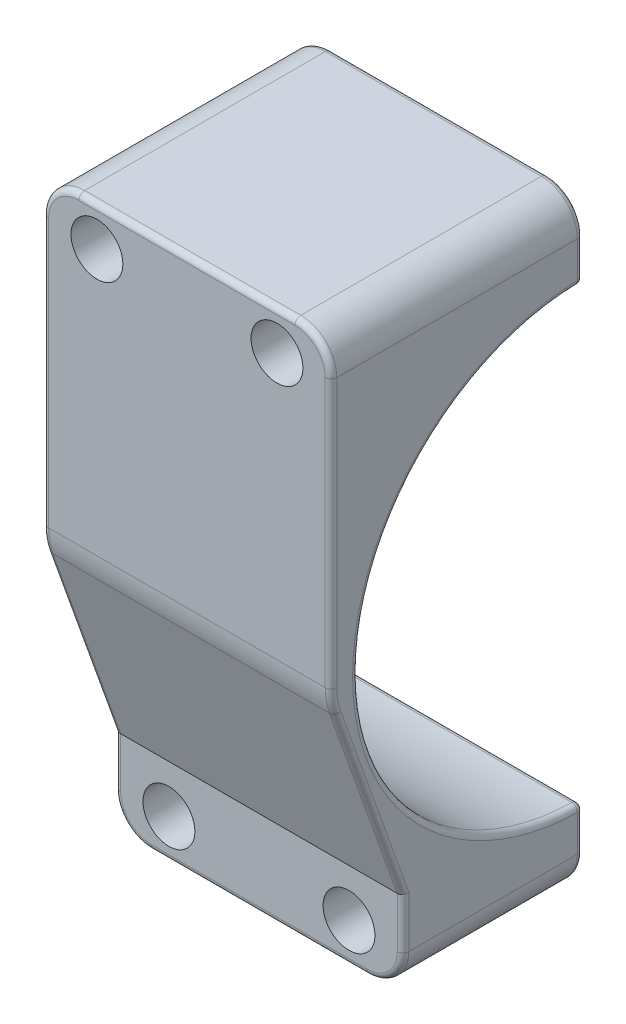
from build123d import *
from build123d.topology import SkipClean

# Parameters (mm, degrees)
BOSS_EXTRUDE1_DEPTH       = 25.4
F_8_0_18_DIAMETER_HOLE1_D = 4.572
SKETCH8_W                 = 22.225
SKETCH8_H                 = 53.34
CUT_EXTRUDE1_DEPTH        = 74.933200255
CUT_EXTRUDE2_DEPTH        = 74.933200255
FILLET1_R                 = 3.175
FILLET3_R                 = 0.508
FILLET4_R                 = 6.35


with BuildPart() as part:
    # Sketch1 → Boss-Extrude1 (new body)
    with BuildSketch(Plane(origin=(0, 0, 0), x_dir=(0, 0, -1), z_dir=(1, 0, 0))):
        with BuildLine():
            Line((0, 0), (0, 53.34))
            Line((0, 53.34), (-22.225, 53.34))
            Line((-22.225, 53.34), (-22.225, 46.482))
            ThreePointArc((-22.225, 46.482), (-2.413, 26.67), (-22.225, 6.858))
            Line((-22.225, 6.858), (-22.225, 0))
            Line((-22.225, 0), (0, 0))
        make_face()
    boss_extrude1 = extrude(amount=BOSS_EXTRUDE1_DEPTH)

    # #8 (0.18) Diameter Hole1 (through all)
    with Locations(Plane.XY.offset(22.225)):
        with Locations((4.7625, 49.911), (20.6375, 49.911), (20.6375, 3.429), (4.7625, 3.429)):
            f_8_0_18_diameter_hole1 = Hole(F_8_0_18_DIAMETER_HOLE1_D / 2)

    # Mirror1: Boss-Extrude1, #8 (0.18) Diameter Hole1 across plane
    with SkipClean():  # the faces are left unmerged after this step: merging them gives an invalid solid
        add(boss_extrude1.mirror(Plane(origin=(25.4, 53.34, 22.225), x_dir=(1, 0, 0), z_dir=(0, 0, -1))))
        add(f_8_0_18_diameter_hole1.mirror(Plane(origin=(25.4, 53.34, 22.225), x_dir=(1, 0, 0), z_dir=(0, 0, -1))), mode=Mode.SUBTRACT)

    # Sketch8 → Cut-Extrude1 (cut, through all)
    with BuildSketch(Plane.ZY):
        with Locations((11.1125, 26.67)):
            Rectangle(SKETCH8_W, SKETCH8_H)
    extrude(amount=-CUT_EXTRUDE1_DEPTH, mode=Mode.SUBTRACT)

    # Sketch9 → Cut-Extrude2 (cut, through all)
    with BuildSketch(Plane(origin=(25.4, 0, 0), x_dir=(0, 0, -1), z_dir=(1, 0, 0))):
        Polygon((-44.45, 0), (-38.1, 0), (-38.1, 7.62), (-44.45, 25.4), align=None)
    extrude(amount=-CUT_EXTRUDE2_DEPTH, mode=Mode.SUBTRACT)

    # Fillet1
    fillet1_edges = [part.edges().sort_by_distance(p)[0] for p in [
        (0, 0, 30.1625),
        (25.4, 0, 30.1625),
        (0, 53.34, 33.3375),
        (25.4, 53.34, 33.3375),
    ]]
    fillet(fillet1_edges, radius=FILLET1_R)

    # Fillet3
    fillet3_edges = [part.edges().sort_by_distance(p)[0] for p in [
        (0, 37.7825, 44.45),
        (25.4, 37.7825, 44.45),
        (0, 16.51, 41.275),
        (25.4, 16.51, 41.275),
        (12.7, 0, 38.1),
        (12.7, 0, 22.225),
        (25.4, 5.0165, 22.225),
        (0, 5.0165, 22.225),
        (24.47006403, 0.92993597, 22.225),
        (0.92993597, 0.92993597, 22.225),
        (0, 5.3975, 38.1),
        (25.4, 5.3975, 38.1),
        (24.47006403, 0.92993597, 38.1),
        (0.92993597, 0.92993597, 38.1),
        (12.7, 53.34, 44.45),
        (0.92993597, 52.41006403, 44.45),
        (24.47006403, 52.41006403, 44.45),
        (12.7, 53.34, 22.225),
        (0.92993597, 52.41006403, 22.225),
        (24.47006403, 52.41006403, 22.225),
        (25.4, 26.67, 42.037),
        (0, 26.67, 42.037),
        (0, 48.3235, 22.225),
        (12.7, 46.482, 22.225),
        (25.4, 48.3235, 22.225),
        (12.7, 6.858, 22.225),
    ]]
    fillet(fillet3_edges, radius=FILLET3_R)

    # Fillet4
    # the kernel refuses this fillet: 6.35 mm, written as the material it takes off along each edge
    with BuildSketch(Plane(origin=(25.4, 26.499907309, 38.1), x_dir=(0, 0, 1), z_dir=(0, 1, 0))) as fillet4_piece_1:
        with BuildLine():
            CenterArc((5.842, -0.508), 0.508, 0, 90)
            Line((6.35, -0.508), (6.35, 0))
            Line((6.35, 0), (5.842, 0))
        make_face()
    revolve(axis=Axis((25.4, 26.499907309, 38.1), (1, 0, 0)), revolution_arc=19.653824058, mode=Mode.SUBTRACT)
    with BuildSketch(Plane(origin=(0, 26.499907309, 38.1), x_dir=(0, -0.3363363969981563, 0.9417419115948376), z_dir=(0, -0.9417419115948376, -0.3363363969981563))) as fillet4_piece_2:
        with BuildLine():
            CenterArc((5.842, -0.508), 0.508, 0, 90)
            Line((6.35, -0.508), (6.35, 0))
            Line((6.35, 0), (5.842, 0))
        make_face()
    revolve(axis=Axis((0, 26.499907309, 38.1), (-1, 0, 0)), revolution_arc=19.653824058, mode=Mode.SUBTRACT)
    with BuildSketch(Plane(origin=(25.4, 25.4, 44.45), x_dir=(0, 1, 0), z_dir=(-1, 0, 0))) as fillet4_piece_3:
        with BuildLine():
            CenterArc((FILLET4_R * 0.173213749464, FILLET4_R), FILLET4_R, 250.346175942, 19.653824058)
            Line((-FILLET4_R * 0.163122647534, FILLET4_R * 0.0582580884052), (0, 0))
            Line((0, 0), (FILLET4_R * 0.173213749464, 0))
        make_face()
    extrude(amount=25.4, mode=Mode.SUBTRACT)


solid = part.part
